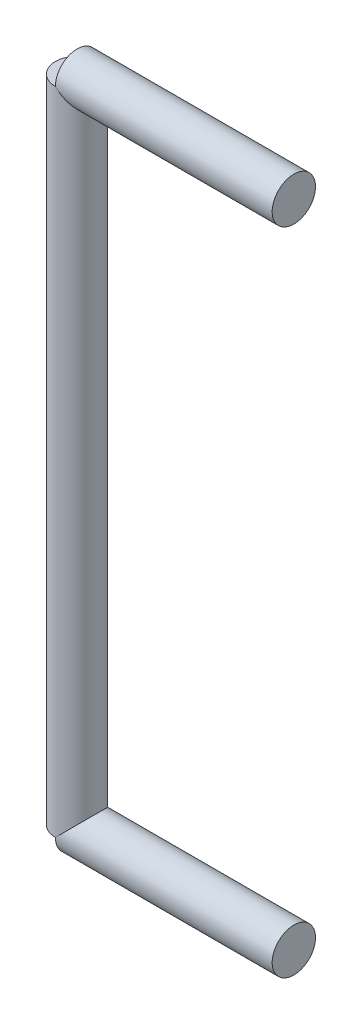
from build123d import *

# Parameters (mm, degrees)
SKETCH1_R           = 0.5
BOSS_EXTRUDE2_DEPTH = 15
SKETCH9_R           = 0.5
BOSS_EXTRUDE3_DEPTH = 5


with BuildPart() as part:
    # Sketch1 → Boss-Extrude2 (new body)
    with BuildSketch(Plane(origin=(0, 0, 0), x_dir=(1, 0, 0), z_dir=(0, 1, 0))):
        Circle(SKETCH1_R)
    extrude(amount=BOSS_EXTRUDE2_DEPTH)

    # Sketch9 → Boss-Extrude3 (add)
    with BuildSketch(Plane(origin=(0, 0, 0), x_dir=(0, 0, -1), z_dir=(1, 0, 0))):
        Circle(SKETCH9_R)
        with Locations((0, 15)):
            Circle(SKETCH9_R)
    extrude(amount=BOSS_EXTRUDE3_DEPTH)


solid = part.part
